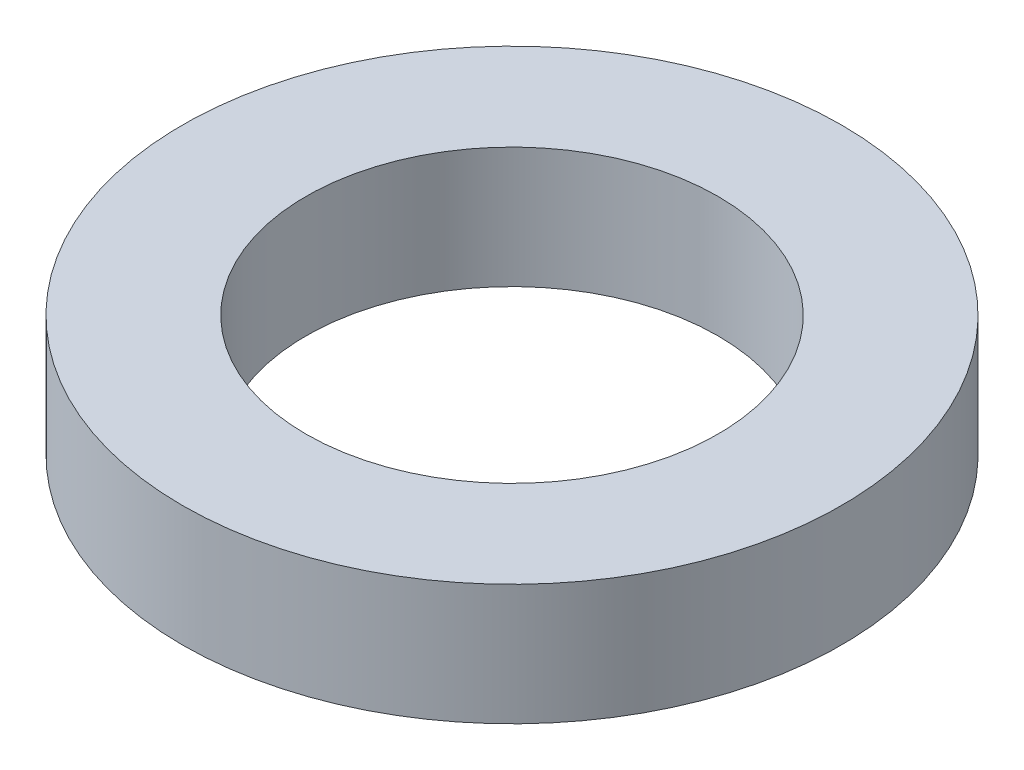
from build123d import *

# Parameters (mm, degrees)
SKETCH1_R           = 60
BOSS_EXTRUDE1_DEPTH = 22
SKETCH2_R           = 37.5
CUT_EXTRUDE1_DEPTH  = 88.658428003


with BuildPart() as part:
    # Sketch1 → Boss-Extrude1 (new body)
    with BuildSketch(Plane(origin=(0, 0, 0), x_dir=(1, 0, 0), z_dir=(0, 1, 0))):
        Circle(SKETCH1_R)
    extrude(amount=BOSS_EXTRUDE1_DEPTH)

    # Sketch2 → Cut-Extrude1 (cut, through all)
    with BuildSketch(Plane(origin=(0, 0, 0), x_dir=(1, 0, 0), z_dir=(0, 1, 0))):
        Circle(SKETCH2_R)
    extrude(amount=CUT_EXTRUDE1_DEPTH, mode=Mode.SUBTRACT)


solid = part.part
